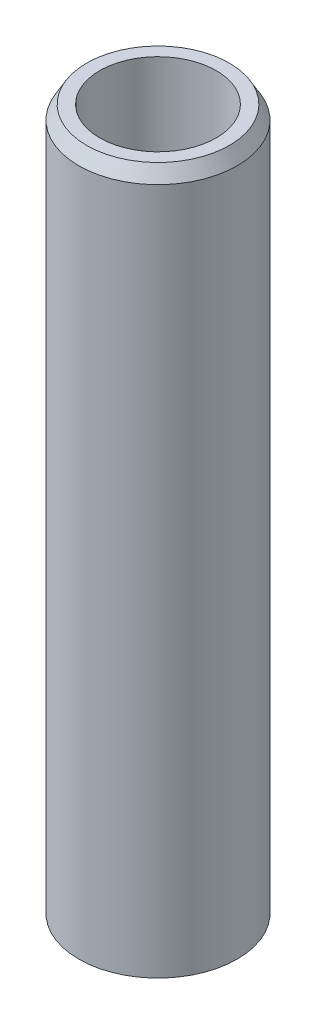
from build123d import *
from OCP.BRepFilletAPI import BRepFilletAPI_MakeChamfer

# Parameters (mm, degrees)
SKETCH1_R           = 20
BOSS_EXTRUDE1_DEPTH = 178.879486772
SKETCH2_R           = 14.715946745
CUT_EXTRUDE1_DEPTH  = 182.101824363
CHAMFER1_SIZE       = 3.443627384
CHAMFER1_SIZE2      = 1.988179197


with BuildPart() as part:
    # Sketch1 → Boss-Extrude1 (new body)
    with BuildSketch(Plane(origin=(0, 0, 0), x_dir=(1, 0, 0), z_dir=(0, 1, 0))):
        Circle(SKETCH1_R)
    extrude(amount=BOSS_EXTRUDE1_DEPTH)

    # Sketch2 → Cut-Extrude1 (cut, through all)
    with BuildSketch(Plane(origin=(0, 0, 0), x_dir=(1, 0, 0), z_dir=(0, 1, 0))):
        Circle(SKETCH2_R)
    extrude(amount=CUT_EXTRUDE1_DEPTH, mode=Mode.SUBTRACT)

    # Chamfer1: one chamfer whose edges measure the first distance from different faces: ONE call of the kernel's chamfer builder (chamfer() names one face for all edges)
    chamfer1_edges_1 = [part.edges().sort_by_distance(p)[0] for p in [
        (-20, 178.879486772, 0),
    ]]
    chamfer1_side_1 = [part.faces().sort_by_distance(p)[0] for p in [
        (-20, 89.439743386, 0),
    ]]
    chamfer1_edges_2 = [part.edges().sort_by_distance(p)[0] for p in [
        (-20, 0, 0),
    ]]
    chamfer1_side_2 = [part.faces().sort_by_distance(p)[0] for p in [
        (-19.434314575, 0, 0),
    ]]
    chamfer1 = BRepFilletAPI_MakeChamfer(part.part.solid().wrapped)
    for e in chamfer1_edges_1:
        chamfer1.Add(CHAMFER1_SIZE, CHAMFER1_SIZE2, e.wrapped, chamfer1_side_1[0].wrapped)  # the first distance lies on this face
    for e in chamfer1_edges_2:
        chamfer1.Add(CHAMFER1_SIZE, CHAMFER1_SIZE2, e.wrapped, chamfer1_side_2[0].wrapped)  # the first distance lies on this face
    add(Compound.cast(chamfer1.Shape()), mode=Mode.REPLACE)


solid = part.part
